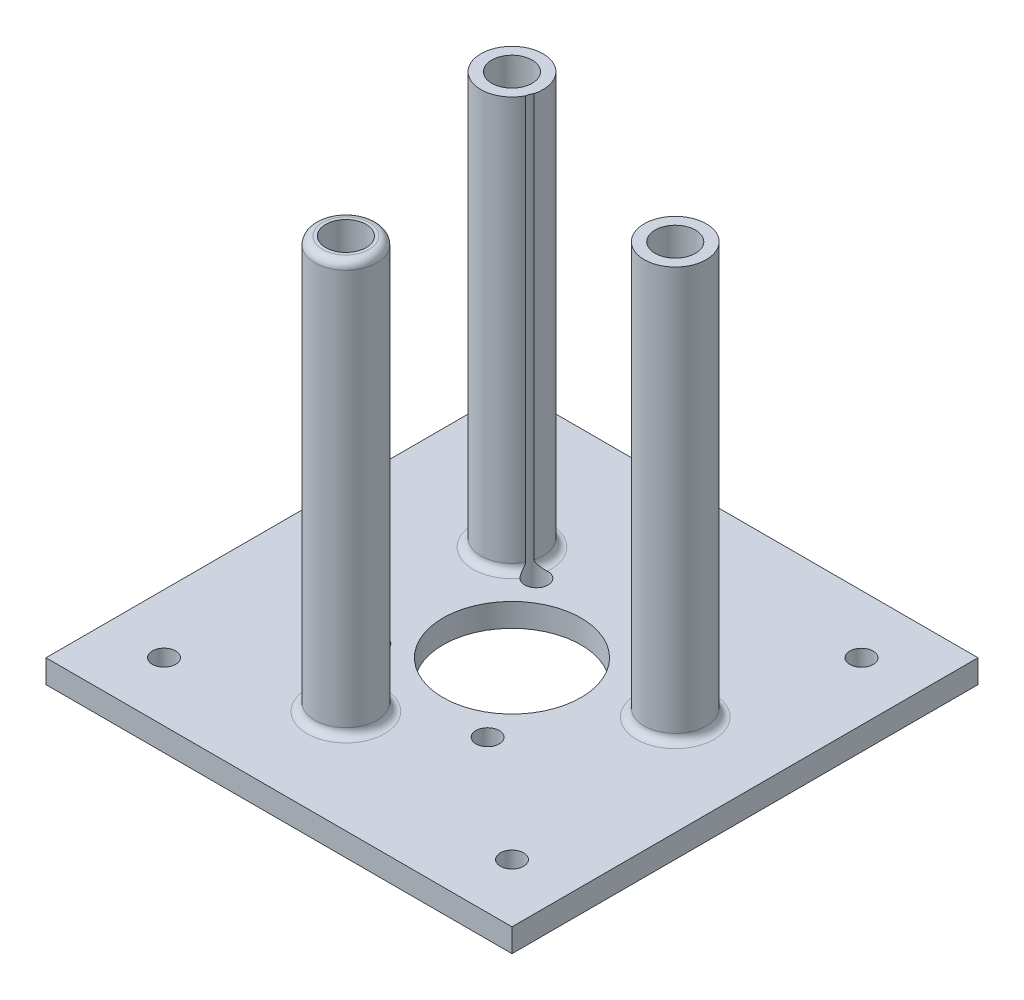
from build123d import *

# Parameters (mm, degrees)
SKETCH1_W                 = 60
SKETCH1_H                 = 60
SKETCH1_R                 = 8.884108342
SKETCH1_R_2               = 1.5
BOSS_EXTRUDE2_DEPTH       = 3
SKETCH2_R                 = 1.5
CUT_EXTRUDE1_DEPTH        = 10
BOSS_EXTRUDE3_OUTLINE_R   = 2.6
BOSS_EXTRUDE3_OUTLINE_R_2 = 4
BOSS_EXTRUDE3_DEPTH       = 53
FILLET1_R                 = 1
FILLET2_R                 = 1


# Read off the part's stored shape, not the designer's step: Boss-Extrude3
with BuildPart() as part:
    # Sketch1 → Boss-Extrude2 (new body)
    with BuildSketch(Plane(origin=(0, 0, 0), x_dir=(1, 0, 0), z_dir=(0, 1, 0))):
        with Locations((-0.083367938, -0.111157251)):
            Rectangle(SKETCH1_W, SKETCH1_H)
        with Locations(Location((-0.083367938, -0.111157251, 0), (0, 0, 270))):
            Circle(SKETCH1_R, mode=Mode.SUBTRACT)
        with Locations(Location((-10.515094807, -7.403555658, 0), (0, 0, 270))):
            Circle(SKETCH1_R_2, mode=Mode.SUBTRACT)
        with Locations(Location((7.209030469, -10.54288412, 0), (0, 0, 270))):
            Circle(SKETCH1_R_2, mode=Mode.SUBTRACT)
        with Locations(Location((10.348358931, 7.181241156, 0), (0, 0, 270))):
            Circle(SKETCH1_R_2, mode=Mode.SUBTRACT)
        with Locations(Location((-7.375766345, 10.320569618, 0), (0, 0, 270))):
            Circle(SKETCH1_R_2, mode=Mode.SUBTRACT)
    extrude(amount=BOSS_EXTRUDE2_DEPTH)

    # Sketch2 → Cut-Extrude1 (cut)
    with BuildSketch(Plane(origin=(0, 3, 0), x_dir=(1, 0, 0), z_dir=(0, 1, 0))):
        with Locations(Location((-22.583367938, 22.388842749, 0), (0, 0, 270))):
            Circle(SKETCH2_R)
        with Locations(Location((22.416632062, 22.388842749, 0), (0, 0, 270))):
            Circle(SKETCH2_R)
        with Locations(Location((22.416632062, -22.611157251, 0), (0, 0, 270))):
            Circle(SKETCH2_R)
        with Locations(Location((-22.5, -22.5, 0), (0, 0, 270))):
            Circle(SKETCH2_R)
    extrude(amount=-CUT_EXTRUDE1_DEPTH, mode=Mode.SUBTRACT)

    # Boss-Extrude3 outline → Boss-Extrude3 (add)
    # profile 1 of 3: a face of its own
    with BuildSketch(Plane(origin=(0, 3, 0), x_dir=(1, 0, 0), z_dir=(0, 1, 0))):
        with BuildLine():
            ThreePointArc((-8.871870842, 10.428603567), (-8.778562467, 10.85175983), (-8.568187528, 11.230587048))
            ThreePointArc((-8.568187528, 11.230587048), (-16.180054368, 13.654447968), (-8.871870842, 10.428603567))
        make_face()
        with Locations((-12.43926471, 12.237940737)):
            Circle(BOSS_EXTRUDE3_OUTLINE_R, mode=Mode.SUBTRACT)
    # profile 2 of 3: a face of its own
    with BuildSketch(Plane(origin=(0, 3, 0), x_dir=(1, 0, 0), z_dir=(0, 1, 0))):
        with Locations((-4.806777383, -16.774903612)):
            Circle(BOSS_EXTRUDE3_OUTLINE_R_2)
        with Locations((-4.806777383, -16.774903612)):
            Circle(BOSS_EXTRUDE3_OUTLINE_R, mode=Mode.SUBTRACT)
    # profile 3 of 3: a face of its own
    with BuildSketch(Plane(origin=(0, 3, 0), x_dir=(1, 0, 0), z_dir=(0, 1, 0))):
        with Locations((17.032817093, 3.792840871)):
            Circle(BOSS_EXTRUDE3_OUTLINE_R_2)
        with Locations((17.032817093, 3.792840871)):
            Circle(BOSS_EXTRUDE3_OUTLINE_R, mode=Mode.SUBTRACT)
    extrude(amount=BOSS_EXTRUDE3_DEPTH)

    # Fillet1
    # the kernel refuses this fillet: 1 mm, written as the material it adds along each edge
    with BuildSketch(Plane(origin=(-12.43926471, 3, -12.237940737), x_dir=(0.9363053197768356, 0, 0.3511870557944836), z_dir=(-0.3511870557944836, 0, 0.9363053197768356))) as fillet1_piece_1_section:
        with BuildLine():
            CenterArc((4 + FILLET1_R, FILLET1_R), FILLET1_R, 180, 90)
            Line((4, FILLET1_R), (4, 0))
            Line((4, 0), (4 + FILLET1_R, 0))
        make_face()
    fillet1_piece_1 = revolve(axis=Axis((-12.43926471, 3, -12.237940737), (0, 1, 0)), revolution_arc=359.64, mode=Mode.PRIVATE)
    fillet1_piece_1 = fillet1_piece_1 - Plane(origin=(-7.375766345, 3.279775491, -10.320569618), x_dir=(0, 0, 1), z_dir=(0, -1, 0)) * Cylinder(1.5, 21, mode=Mode.PRIVATE)
    add(fillet1_piece_1)

    # Fillet2
    fillet2_edges = [part.edges().sort_by_distance(p)[0] for p in [
        (-8.806777383, 3, 16.774903612),
        (-8.806777383, 56, 16.774903612),
        (13.032817093, 3, -3.792840871),
    ]]
    fillet(fillet2_edges, radius=FILLET2_R)


solid = part.part
